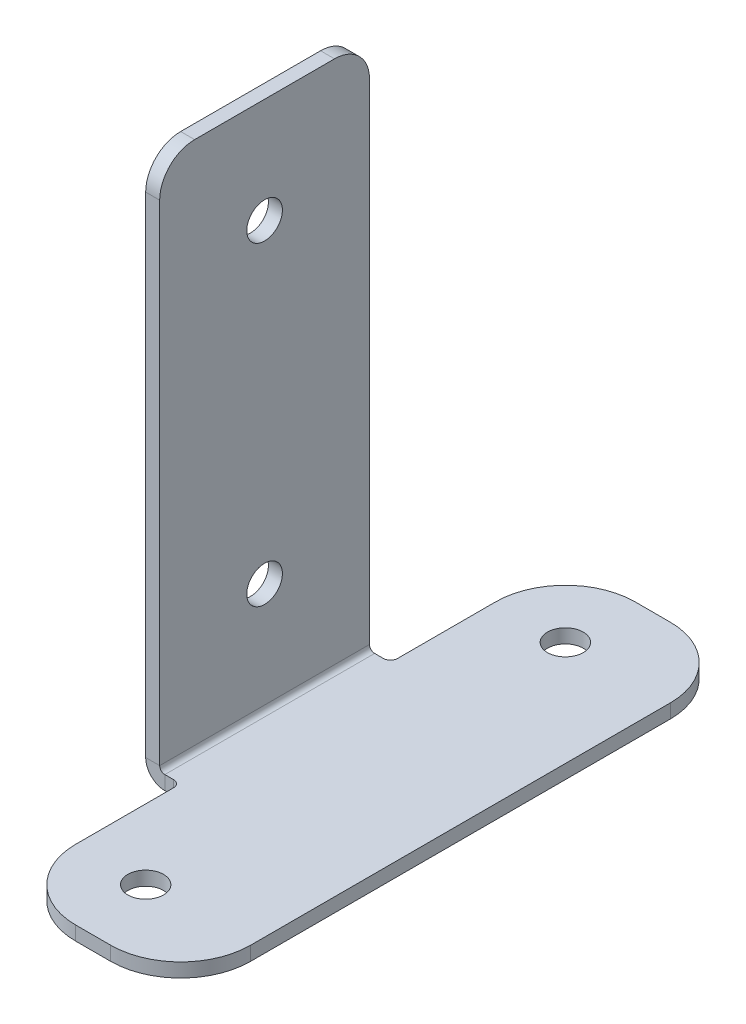
from build123d import *

# Parameters (mm, degrees)
SKETCH1_R                  = 2.55
BASE_FLANGE1_DEPTH         = 2
SKETCHED_START             = -90
SKETCHED_BEND1_OUTLINE_W   = 2
SKETCHED_BEND1_OUTLINE_H   = 30
SKETCHED_BEND1_DEPTH       = 75
SKETCHED_START_2           = -14.733838284
SKETCHED_BEND1_2_OUTLINE_R = 2.55
SKETCHED_BEND1_2_DEPTH     = 1.733838284
SKETCHED_START_3           = -15
SKETCHED_BEND1_3_OUTLINE_R = 2.55
SKETCHED_BEND1_3_DEPTH     = 2.7366
SKETCHED_START_4           = -16
SKETCHED_BEND1_4_DEPTH     = 31


with BuildPart() as part:
    # Base-Flange1: sheet metal written as solids
    # Sketch1 → Base-Flange1 (new body)
    with BuildSketch(Plane(origin=(0, 0, 0), x_dir=(1, 0, 0), z_dir=(0, 1, 0))):
        with BuildLine():
            Line((0, 40), (5, 40))
            ThreePointArc((5, 40), (12.071067812, 37.071067812), (15, 30))
            Line((15, 30), (15, 0))
            Line((15, 0), (15, -30))
            ThreePointArc((15, -30), (12.071067812, -37.071067812), (5, -40))
            Line((5, -40), (0, -40))
            ThreePointArc((0, -40), (-7.071067812, -37.071067812), (-10, -30))
            Line((-10, -30), (-10, -16))
            ThreePointArc((-10, -16), (-10.292893219, -15.292893219), (-11, -15))
            Line((-11, -15), (-20, -15))
            Line((-20, -15), (-85, -15))
            ThreePointArc((-85, -15), (-88.535533906, -13.535533906), (-90, -10))
            Line((-90, -10), (-90, 10))
            ThreePointArc((-90, 10), (-88.535533906, 13.535533906), (-85, 15))
            Line((-85, 15), (-20, 15))
            Line((-20, 15), (-11, 15))
            ThreePointArc((-11, 15), (-10.292893219, 15.292893219), (-10, 16))
            Line((-10, 16), (-10, 30))
            ThreePointArc((-10, 30), (-7.071067812, 37.071067812), (0, 40))
        make_face()
        with Locations(Location((0, -30, 0), (0, 0, 90))):
            Circle(SKETCH1_R, mode=Mode.SUBTRACT)
        with Locations(Location((0, 30, 0), (0, 0, 270))):
            Circle(SKETCH1_R, mode=Mode.SUBTRACT)
        with Locations(Location((-75, 0, 0), (0, 0, 270))):
            Circle(SKETCH1_R, mode=Mode.SUBTRACT)
        with Locations(Location((-30, 0, 0), (0, 0, 270))):
            Circle(SKETCH1_R, mode=Mode.SUBTRACT)
    extrude(amount=-BASE_FLANGE1_DEPTH)

    # Sketched Bend1: read off the stored shape, not the designer's step
    # Sketched Bend1 outline → Sketched Bend1 (cut)
    with BuildSketch(Plane.YZ.offset(SKETCHED_START)):
        with Locations((-1, 0)):
            Rectangle(SKETCHED_BEND1_OUTLINE_W, SKETCHED_BEND1_OUTLINE_H)
    extrude(amount=SKETCHED_BEND1_DEPTH, mode=Mode.SUBTRACT)

    # Sketched Bend1 2 outline → Sketched Bend1 2 (add)
    with BuildSketch(Plane.YZ.offset(SKETCHED_START_2)):
        with BuildLine():
            ThreePointArc((75.745355099, 10), (74.280889005, 13.535533906), (70.745355099, 15))
            Line((70.745355099, 15), (0, 15))
            Line((0, 15), (0, -15))
            Line((0, -15), (70.745355099, -15))
            ThreePointArc((70.745355099, -15), (74.280889005, -13.535533906), (75.745355099, -10))
            Line((75.745355099, -10), (75.745355099, 10))
        make_face()
        with Locations((15.745355099, 0)):
            Circle(SKETCHED_BEND1_2_OUTLINE_R, mode=Mode.SUBTRACT)
        with Locations((60.745355099, 0)):
            Circle(SKETCHED_BEND1_2_OUTLINE_R, mode=Mode.SUBTRACT)
    extrude(amount=SKETCHED_BEND1_2_DEPTH)

    # Sketched Bend1 3 outline → Sketched Bend1 3 (add)
    with BuildSketch(Plane.YZ.offset(SKETCHED_START_3)):
        with BuildLine():
            ThreePointArc((75.745355099, 10), (74.280889005, 13.535533906), (70.745355099, 15))
            Line((70.745355099, 15), (0, 15))
            Line((0, 15), (0, -15))
            Line((0, -15), (70.745355099, -15))
            ThreePointArc((70.745355099, -15), (74.280889005, -13.535533906), (75.745355099, -10))
            Line((75.745355099, -10), (75.745355099, 10))
        make_face()
        with Locations((15.745355099, 0)):
            Circle(SKETCHED_BEND1_3_OUTLINE_R, mode=Mode.SUBTRACT)
        with Locations((60.745355099, 0)):
            Circle(SKETCHED_BEND1_3_OUTLINE_R, mode=Mode.SUBTRACT)
    extrude(amount=SKETCHED_BEND1_3_DEPTH)

    # Sketched Bend1 4 outline → Sketched Bend1 4 (cut)
    with BuildSketch(Plane.XY.offset(SKETCHED_START_4)):
        with BuildLine():
            Line((-12.2634, 75.745355099), (-13, 75.745355099))
            Line((-13, 75.745355099), (-13, 0.7366))
            ThreePointArc((-13, 0.7366), (-12.784254855, 0.215745145), (-12.2634, 0))
            Line((-12.2634, 0), (-12.2634, 75.745355099))
        make_face()
        with BuildLine():
            ThreePointArc((-12.2634, -2), (-14.198468417, -1.198468417), (-15, 0.7366))
            Line((-15, 0.7366), (-15, -2))
            Line((-15, -2), (-12.2634, -2))
        make_face()
    extrude(amount=SKETCHED_BEND1_4_DEPTH, mode=Mode.SUBTRACT)


solid = part.part
